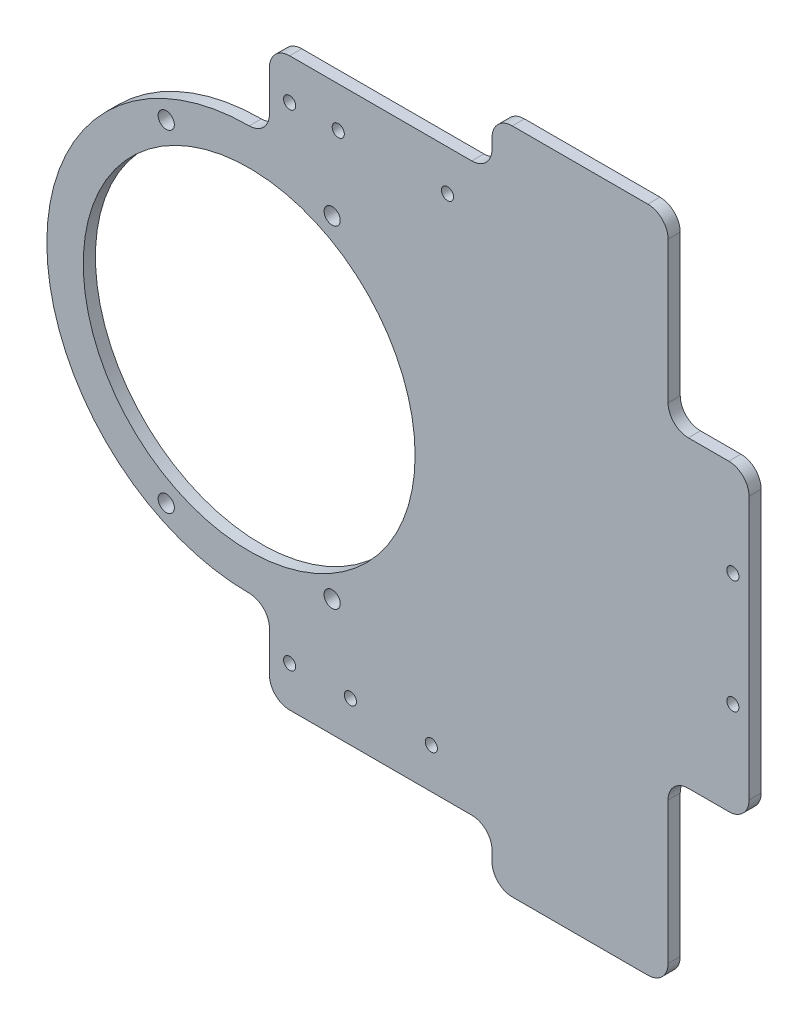
from build123d import *

# Parameters (mm, degrees)
SKETCH_1_W          = 110
SKETCH_1_H          = 100
SKETCH_1_W_2        = 55
SKETCH_1_H_2        = 20
EXTRUDE_1_DEPTH     = 3
FILLET_1_R          = 50
SKETCH_2_R          = 41
CUT_EXTRUDE_1_DEPTH = 10
FILLET_4_R          = 5
SKETCH_3_R          = 1.5
SKETCH_3_R_2        = 2
CUT_EXTRUDE_2_DEPTH = 10
SKETCH_4_W          = 20
SKETCH_4_H          = 45
CUT_EXTRUDE_3_DEPTH = 10
FILLET_5_R          = 5


with BuildPart() as part:
    # 草图1 → 凸台-拉伸1 (new body)
    with BuildSketch(Plane.XY):
        Rectangle(SKETCH_1_W, SKETCH_1_H)
        Polygon((55, 70), (55, 50), (55, -50), (55, -70), (55, -82.5), (118.5, -82.5), (118.5, 82.5), (55, 82.5), align=None)
        with Locations((27.5, 60)):
            Rectangle(SKETCH_1_W_2, SKETCH_1_H_2)
        with Locations((27.5, -60)):
            Rectangle(SKETCH_1_W_2, SKETCH_1_H_2)
    extrude(amount=EXTRUDE_1_DEPTH)

    # 圆角1
    fillet_1_edges = [part.edges().sort_by_distance(p)[0] for p in [
        (-55, -50, 1.5),
        (-55, 50, 1.5),
    ]]
    fillet(fillet_1_edges, radius=FILLET_1_R - 0.0001)  # a hair under: the kernel refuses the full size

    # 草图2 → 切除-拉伸1 (cut)
    with BuildSketch(Plane.XY.offset(3)):
        with Locations((-5, 0)):
            Circle(SKETCH_2_R)
    extrude(amount=-CUT_EXTRUDE_1_DEPTH, mode=Mode.SUBTRACT)

    # 圆角4
    fillet_4_edges = [part.edges().sort_by_distance(p)[0] for p in [
        (0, -70, 1.5),
        (0, -50, 1.5),
        (0, 50, 1.5),
        (0, 70, 1.5),
        (55, 70, 1.5),
        (55, -70, 1.5),
    ]]
    fillet(fillet_4_edges, radius=FILLET_4_R)

    # 草图3 → 切除-拉伸2 (cut)
    with BuildSketch(Plane.XY.offset(3)):
        with Locations((114.5, 14)):
            Circle(SKETCH_3_R)
        with Locations((114.5, -14)):
            Circle(SKETCH_3_R)
        with Locations((-25.5, 41)):
            Circle(SKETCH_3_R_2)
        with Locations((15.5, 41)):
            Circle(SKETCH_3_R_2)
        with Locations((15.5, -41)):
            Circle(SKETCH_3_R_2)
        with Locations((-25.5, -41)):
            Circle(SKETCH_3_R_2)
        with Locations((5, -60)):
            Circle(SKETCH_3_R)
        with Locations((20, -60)):
            Circle(SKETCH_3_R)
        with Locations((40, -60)):
            Circle(SKETCH_3_R)
        with Locations((5, 60)):
            Circle(SKETCH_3_R)
        with Locations((17, 60)):
            Circle(SKETCH_3_R)
        with Locations((44, 60)):
            Circle(SKETCH_3_R)
    extrude(amount=-CUT_EXTRUDE_2_DEPTH, mode=Mode.SUBTRACT)

    # 草图4 → 切除-拉伸3 (cut)
    with BuildSketch(Plane.XY.offset(3)):
        with Locations((108.5, 60)):
            Rectangle(SKETCH_4_W, SKETCH_4_H)
        with Locations((108.5, -60)):
            Rectangle(SKETCH_4_W, SKETCH_4_H)
    extrude(amount=-CUT_EXTRUDE_3_DEPTH, mode=Mode.SUBTRACT)

    # 圆角5
    fillet_5_edges = [part.edges().sort_by_distance(p)[0] for p in [
        (98.5, 82.5, 1.5),
        (118.5, 37.5, 1.5),
        (98.5, 37.5, 1.5),
        (98.5, -82.5, 1.5),
        (98.5, -37.5, 1.5),
        (118.5, -37.5, 1.5),
        (55, 82.5, 1.5),
        (55, -82.5, 1.5),
    ]]
    fillet(fillet_5_edges, radius=FILLET_5_R)


solid = part.part
